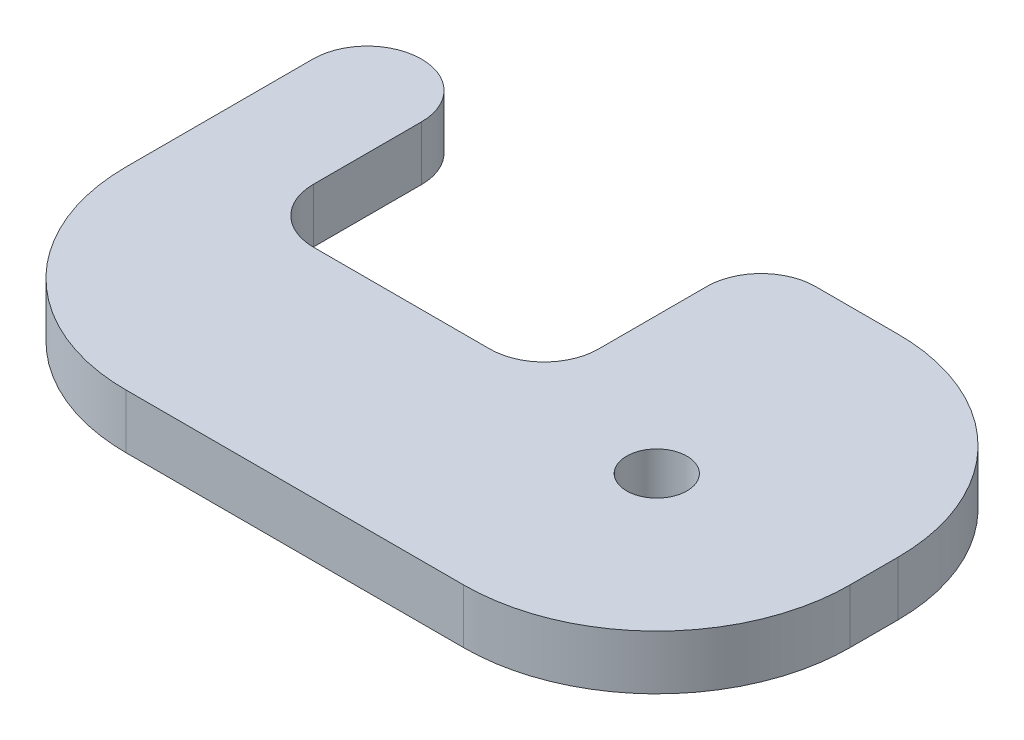
from build123d import *

# Parameters (mm, degrees)
SKETCH1_W           = 38.1
SKETCH1_H           = 22.86
BOSS_EXTRUDE1_DEPTH = 3.175
FILLET1_R           = 10.16
SKETCH3_R           = 1.5875
CUT_EXTRUDE1_DEPTH  = 23.44165825
FILLET3_R           = 10.16
SCALE1_SCALE_X      = 1.11
SCALE1_SCALE_Y      = 1
SCALE1_SCALE_Z      = 1.11
SKETCH4_W           = 16.66240239
SKETCH4_H           = 12.6746
CUT_EXTRUDE2_DEPTH  = 25.930165729
FILLET7_R           = 3.175


with BuildPart() as part:
    # Sketch1 → Boss-Extrude1 (new body)
    with BuildSketch(Plane(origin=(0, 0, 0), x_dir=(1, 0, 0), z_dir=(0, 1, 0))):
        Rectangle(SKETCH1_W, SKETCH1_H)
    extrude(amount=BOSS_EXTRUDE1_DEPTH)

    # Fillet1
    fillet1_edges = [part.edges().sort_by_distance(p)[0] for p in [
        (19.05, 1.5875, 11.43),
        (-19.05, 1.5875, 11.43),
    ]]
    fillet(fillet1_edges, radius=FILLET1_R)

    # Sketch3 → Cut-Extrude1 (cut, through all)
    with BuildSketch(Plane(origin=(0, 3.175, 0), x_dir=(1, 0, 0), z_dir=(0, 1, 0))):
        with Locations(Location((8.89, -1.27, 0), (0, 0, 270))):
            Circle(SKETCH3_R)
    extrude(amount=-CUT_EXTRUDE1_DEPTH, mode=Mode.SUBTRACT)

    # Fillet3
    fillet3_edges = [part.edges().sort_by_distance(p)[0] for p in [
        (19.05, 1.5875, -11.43),
    ]]
    fillet(fillet3_edges, radius=FILLET3_R)


with BuildPart() as part_1:
    # Scale1: scaled about (-0.555008507, 1.5875, -0.267369012)
    add(part.part.scale((SCALE1_SCALE_X, SCALE1_SCALE_Y, SCALE1_SCALE_Z), about=(-0.555008507, 1.5875, -0.267369012)))

    # Sketch4 → Cut-Extrude2 (cut, through all)
    with BuildSketch(Plane(origin=(0, 3.175, 0), x_dir=(1, 0, 0), z_dir=(0, 1, 0))):
        with Locations((-6.403247869, 6.320589409)):
            Rectangle(SKETCH4_W, SKETCH4_H)
    extrude(amount=-CUT_EXTRUDE2_DEPTH, mode=Mode.SUBTRACT)

    # Fillet7
    fillet7_edges = [part_1.edges().sort_by_distance(p)[0] for p in [
        (-14.734449064, 1.5875, 0.016710591),
        (-14.734449064, 1.5875, -12.657889409),
        (1.927953326, 1.5875, -12.657889409),
        (1.927953326, 1.5875, 0.016710591),
        (-21.084449064, 1.5875, -12.657889409),
    ]]
    fillet(fillet7_edges, radius=FILLET7_R - 0.0001)  # a hair under: the kernel refuses the full size


solid = part_1.part
